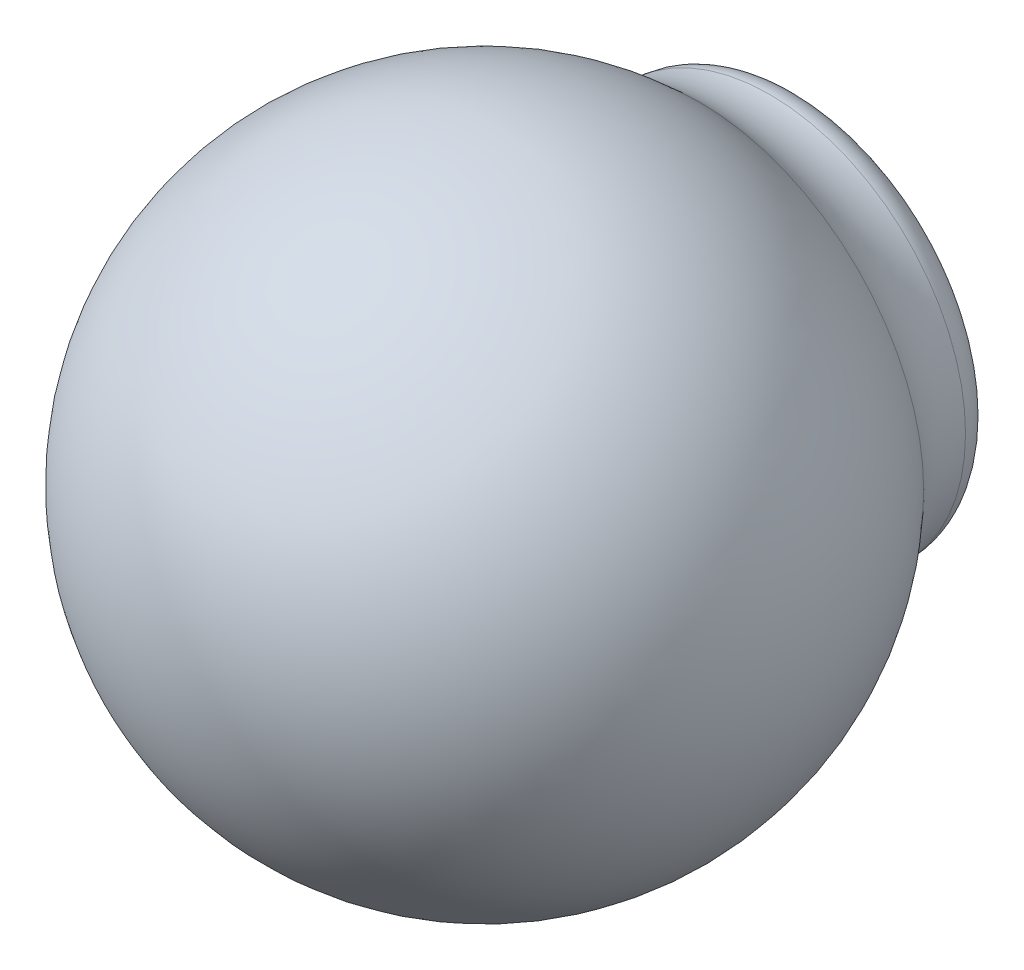
from build123d import *

# Parameters (mm, degrees)
SKETCH2_R           = 18.921523051
SKETCH2_R_2         = 3.4
BOSS_EXTRUDE1_DEPTH = 10
FILLET1_R           = 3
SKETCH3_R           = 18.921523051
SKETCH3_R_2         = 3.4
BOSS_EXTRUDE2_DEPTH = 0.5
SKETCH4_R           = 18.921523051
BOSS_EXTRUDE3_DEPTH = 5
SKETCH8_R           = 18.921523051
BOSS_EXTRUDE4_DEPTH = 15
SKETCH10_R          = 4.25
CUT_EXTRUDE2_DEPTH  = 40
FILLET2_R           = 10
SKETCH11_R          = 3.4
CUT_EXTRUDE3_DEPTH  = 10.5


with BuildPart() as part:
    # Sketch2 → Boss-Extrude1 (new body)
    with BuildSketch(Plane.XY):
        Circle(SKETCH2_R)
        with Locations((0, 11.25277675)):
            Circle(SKETCH2_R_2, mode=Mode.SUBTRACT)
        with Locations((11.25277675, 0)):
            Circle(SKETCH2_R_2, mode=Mode.SUBTRACT)
        with Locations((0, -11.25277675)):
            Circle(SKETCH2_R_2, mode=Mode.SUBTRACT)
        with Locations((-11.25277675, 0)):
            Circle(SKETCH2_R_2, mode=Mode.SUBTRACT)
    extrude(amount=BOSS_EXTRUDE1_DEPTH)

    # Fillet1
    fillet1_edges = [part.edges().sort_by_distance(p)[0] for p in [
        (-18.921523051, 0, 0),
    ]]
    fillet(fillet1_edges, radius=FILLET1_R)

    # Sketch3 → Boss-Extrude2 (add)
    with BuildSketch(Plane.XY.offset(10)):
        Circle(SKETCH3_R)
        with Locations((0, 11.25277675)):
            Circle(SKETCH3_R_2, mode=Mode.SUBTRACT)
        with Locations((11.25277675, 0)):
            Circle(SKETCH3_R_2, mode=Mode.SUBTRACT)
        with Locations((-11.25277675, 0)):
            Circle(SKETCH3_R_2, mode=Mode.SUBTRACT)
        with Locations((0, -11.25277675)):
            Circle(SKETCH3_R_2, mode=Mode.SUBTRACT)
    extrude(amount=BOSS_EXTRUDE2_DEPTH)

    # Sketch4 → Boss-Extrude3 (add)
    with BuildSketch(Plane.XY.offset(10.5)):
        Circle(SKETCH4_R)
    extrude(amount=BOSS_EXTRUDE3_DEPTH)

    # Sketch8 → Boss-Extrude4 (add)
    with BuildSketch(Plane.XY.offset(15.5)):
        Circle(SKETCH8_R)
    extrude(amount=BOSS_EXTRUDE4_DEPTH)

    # Sketch9 → Revolve2 (revolve)
    with BuildSketch(Plane.XY.offset(30.5)):
        with BuildLine():
            ThreePointArc((0, -30), (30, 0), (0, 30))
            Line((0, 30), (0, -30))
        make_face()
    revolve(axis=Axis((0, 0, 30.5), (0, 1, 0)))

    # Sketch10 → Cut-Extrude2 (cut)
    with BuildSketch(Plane(origin=(0, 0, 0), x_dir=(-1, 0, 0), z_dir=(0, 0, -1))):
        Circle(SKETCH10_R)
    extrude(amount=-CUT_EXTRUDE2_DEPTH, mode=Mode.SUBTRACT)

    # Fillet2
    fillet2_edges = [part.edges().sort_by_distance(p)[0] for p in [
        (-18.921523048, 0, 7.219622739),
    ]]
    fillet(fillet2_edges, radius=FILLET2_R)

    # Sketch11 → Cut-Extrude3 (cut)
    with BuildSketch(Plane(origin=(0, 0, 0), x_dir=(-1, 0, 0), z_dir=(0, 0, -1))):
        with Locations((0, -11.25277675)):
            Circle(SKETCH11_R)
        with Locations((-11.25277675, 0)):
            Circle(SKETCH11_R)
        with Locations((0, 11.25277675)):
            Circle(SKETCH11_R)
        with Locations((11.25277675, 0)):
            Circle(SKETCH11_R)
    extrude(amount=-CUT_EXTRUDE3_DEPTH, mode=Mode.SUBTRACT)


solid = part.part
